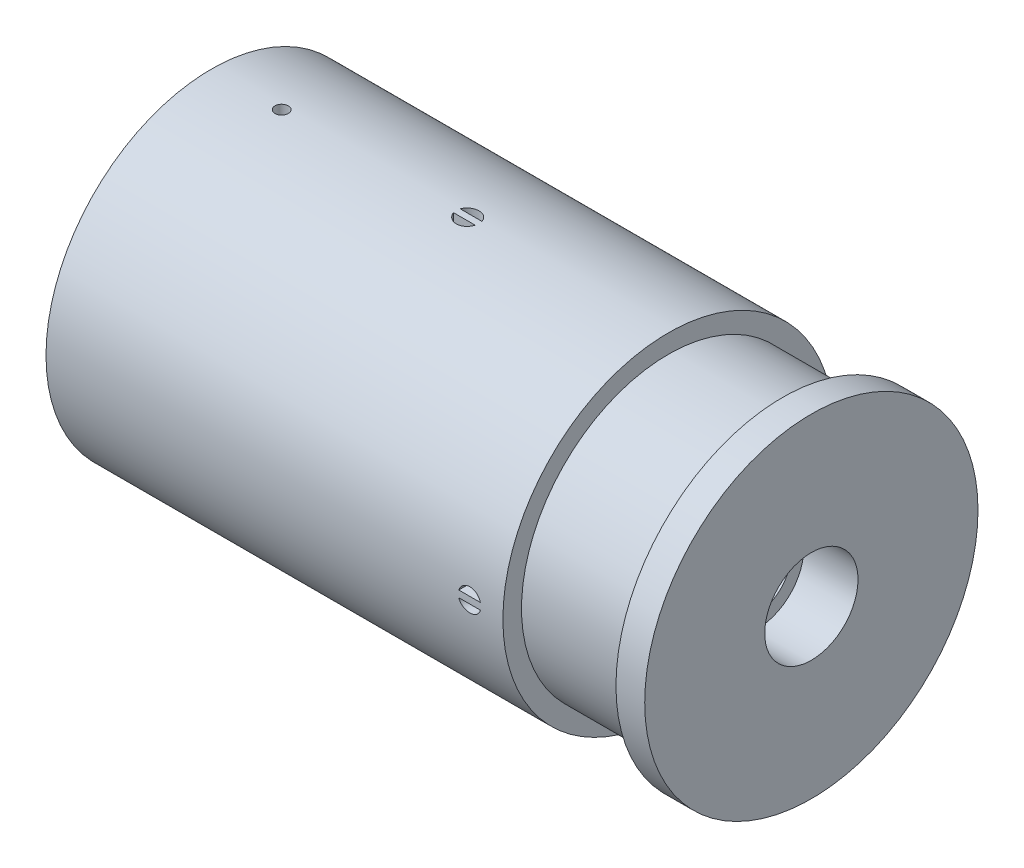
from build123d import *

# Parameters (mm, degrees)
CUT_EXTRUDE1_DEPTH      = 21
CUT_EXTRUDE1_DEPTH_BACK = 22
SKETCH4_R               = 1.7
SKETCH5_R               = 1
CUT_EXTRUDE2_DEPTH      = 21
CUT_EXTRUDE3_DEPTH      = 25
CUT_EXTRUDE4_DEPTH      = 25
SKETCH9_R               = 1
CUT_EXTRUDE5_DEPTH      = 25


with BuildPart() as part:
    # Sketch1 → Revolve1 (revolve)
    with BuildSketch(Plane.XY):
        Polygon((0, 0), (0, 24.820612545), (68.543963981, 24.820612545), (68.543963981, 22.028059354), (85.684459755, 22.028059354), (85.684459755, 25), (90, 25), (90, 0), align=None)
    revolve(axis=Axis((0, 0, 0), (-1, 0, 0)))

    # Sketch3 → Cut-Revolve1 (revolve, cut)
    with BuildSketch(Plane(origin=(0, 0, 0), x_dir=(1, 0, 0), z_dir=(0, 1, 0))):
        Polygon((0, 0), (0, 13), (11.186820081, 13), (11.186820081, 11), (14.393242315, 11), (14.393242315, 9), (69.922645544, 9), (69.922645544, 5), (81.873855688, 5), (81.873855688, 7), (90, 7), (90, 0), align=None)
    revolve(axis=Axis((96.448502204, 0, 0), (-1, 0, 0)), mode=Mode.SUBTRACT)

    # Sketch4 → Cut-Extrude1 (cut, two sides: drawn at the far end of the back side and taken through both)
    with BuildSketch(Plane.XY.offset(-CUT_EXTRUDE1_DEPTH_BACK)):
        with Locations((38.043963981, 0)):
            Circle(SKETCH4_R)
    extrude(amount=CUT_EXTRUDE1_DEPTH + CUT_EXTRUDE1_DEPTH_BACK, mode=Mode.SUBTRACT)

    # Sketch5 → Cut-Extrude2 (cut)
    with BuildSketch(Plane.XY):
        with Locations((10.543963981, 0)):
            Circle(SKETCH5_R)
    extrude(amount=-CUT_EXTRUDE2_DEPTH, mode=Mode.SUBTRACT)

    # Sketch7 → Cut-Extrude3 (cut)
    with BuildSketch(Plane(origin=(0, 25, 0), x_dir=(1, 0, 0), z_dir=(0, 1, 0))):
        with BuildLine():
            Line((36.819156301, 0.5), (40.068771662, 0.5))
            ThreePointArc((40.068771662, 0.5), (38.443963981, 1.7), (36.819156301, 0.5))
        make_face()
        with BuildLine():
            Line((36.819156301, -0.5), (40.068771662, -0.5))
            ThreePointArc((40.068771662, -0.5), (38.443963981, -1.7), (36.819156301, -0.5))
        make_face()
    extrude(amount=-CUT_EXTRUDE3_DEPTH, mode=Mode.SUBTRACT)

    # Sketch8 → Cut-Extrude4 (cut)
    with BuildSketch(Plane.XY.offset(25)):
        with BuildLine():
            Line((61.919156301, 0.5), (65.168771662, 0.5))
            ThreePointArc((65.168771662, 0.5), (63.543963981, 1.7), (61.919156301, 0.5))
        make_face()
        with BuildLine():
            Line((61.919156301, -0.5), (65.168771662, -0.5))
            ThreePointArc((65.168771662, -0.5), (63.543963981, -1.7), (61.919156301, -0.5))
        make_face()
    extrude(amount=-CUT_EXTRUDE4_DEPTH, mode=Mode.SUBTRACT)

    # Sketch9 → Cut-Extrude5 (cut)
    with BuildSketch(Plane(origin=(0, 25, 0), x_dir=(1, 0, 0), z_dir=(0, 1, 0))):
        with Locations((10.543963981, 0)):
            Circle(SKETCH9_R)
    extrude(amount=-CUT_EXTRUDE5_DEPTH, mode=Mode.SUBTRACT)


solid = part.part
